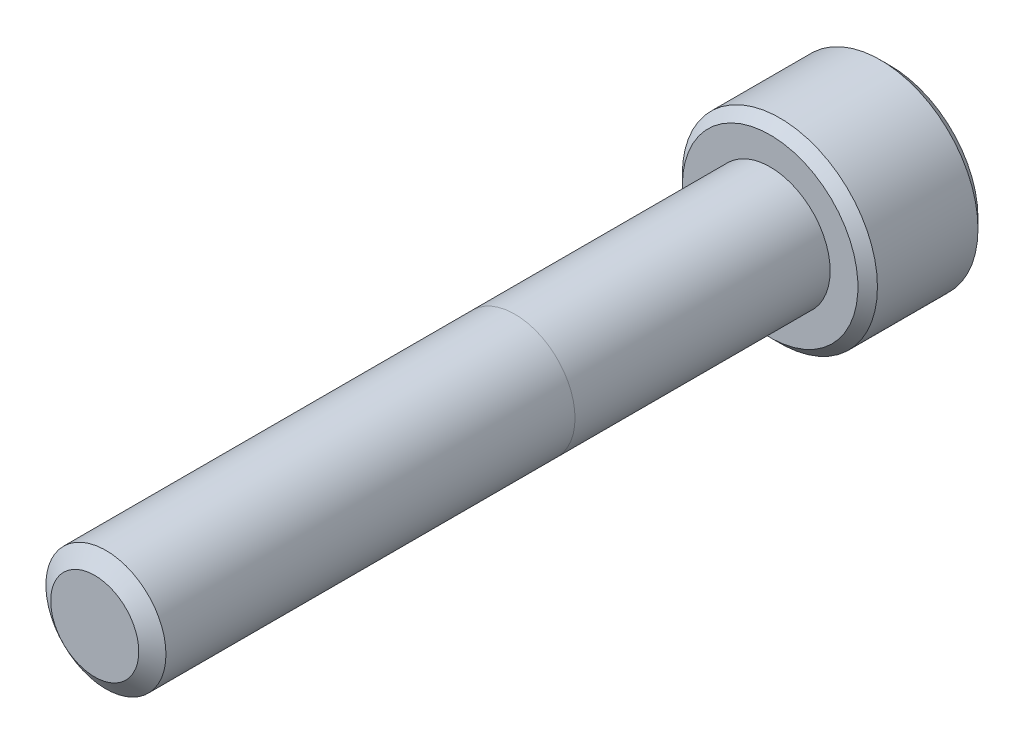
from build123d import *

# Parameters (mm, degrees)
SKETCH1_R            = 4
EXTRUDE1_DEPTH       = 45
SKETCH6_R            = 6.5
EXTRUDE2_DEPTH       = 8
CUT_EXTRUDE1_DEPTH   = 4.5
CHAMFER1_SIZE        = 0.65
SKETCH10_R           = 4
PARTIAL_THREAD_DEPTH = 17
CHAMFER2_SIZE        = 0.16


with BuildPart() as part:
    # Sketch1 → Extrude1 (new body)
    with BuildSketch(Plane.XY):
        Circle(SKETCH1_R)
    extrude(amount=-EXTRUDE1_DEPTH)

    # Sketch4 → Cut-Revolve1 (revolve, cut)
    with BuildSketch(Plane(origin=(0, 0, 0), x_dir=(0, 0, -1), z_dir=(1, 0, 0)), mode=Mode.PRIVATE) as cut_revolve1_sk:
        Polygon((0.746350386, 4), (0, 2.934101184), (0, 4), align=None)
    revolve(cut_revolve1_sk.sketch.rotate(Axis((0, 0, 0), (0, 0, -1)), 90), axis=Axis((0, 0, 0), (0, 0, -1)), mode=Mode.SUBTRACT)

    # Sketch6 → Extrude2 (add)
    with BuildSketch(Plane(origin=(0, 0, -45), x_dir=(-1, 0, 0), z_dir=(0, 0, -1))):
        Circle(SKETCH6_R)
    extrude(amount=EXTRUDE2_DEPTH)

    # Sketch7 → Cut-Extrude1 (cut)
    with BuildSketch(Plane(origin=(0, 0, -53), x_dir=(-1, 0, 0), z_dir=(0, 0, -1))):
        Polygon((0, 3.464101615), (-3, 1.732050808), (-3, -1.732050808), (0, -3.464101615), (3, -1.732050808), (3, 1.732050808), align=None)
    extrude(amount=-CUT_EXTRUDE1_DEPTH, mode=Mode.SUBTRACT)

    # Cut-Extrude2 cone 1 section (through the dimple's axis) → Cut-Extrude2 (revolve, cut)
    with BuildSketch(Plane(origin=(0, 0, -53), x_dir=(0, 1, 0), z_dir=(1, 0, 0))):
        Polygon((0, 0), (3.464101615, 0), (0, 3.464101615), align=None)
    revolve(axis=Axis((0, 0, -53), (0, 0, 1)), mode=Mode.SUBTRACT)

    # Chamfer1
    chamfer1_edges = [part.edges().sort_by_distance(p)[0] for p in [
        (6.5, 0, -45),
        (6.5, 0, -53),
    ]]
    chamfer(chamfer1_edges, length=CHAMFER1_SIZE)


with BuildPart() as body_2:
    # Sketch10 → partial thread (new body)
    with BuildSketch(Plane.XY.offset(-45)):
        Circle(SKETCH10_R)
    extrude(amount=PARTIAL_THREAD_DEPTH)

    # Chamfer2
    chamfer2_edges = [body_2.edges().sort_by_distance(p)[0] for p in [
        (-4, 0, -28),
    ]]
    chamfer(chamfer2_edges, length=CHAMFER2_SIZE)


with BuildPart() as part_1:
    add(part.part)

    # Combine1: union body 2
    add(body_2.part)


solid = part_1.part
